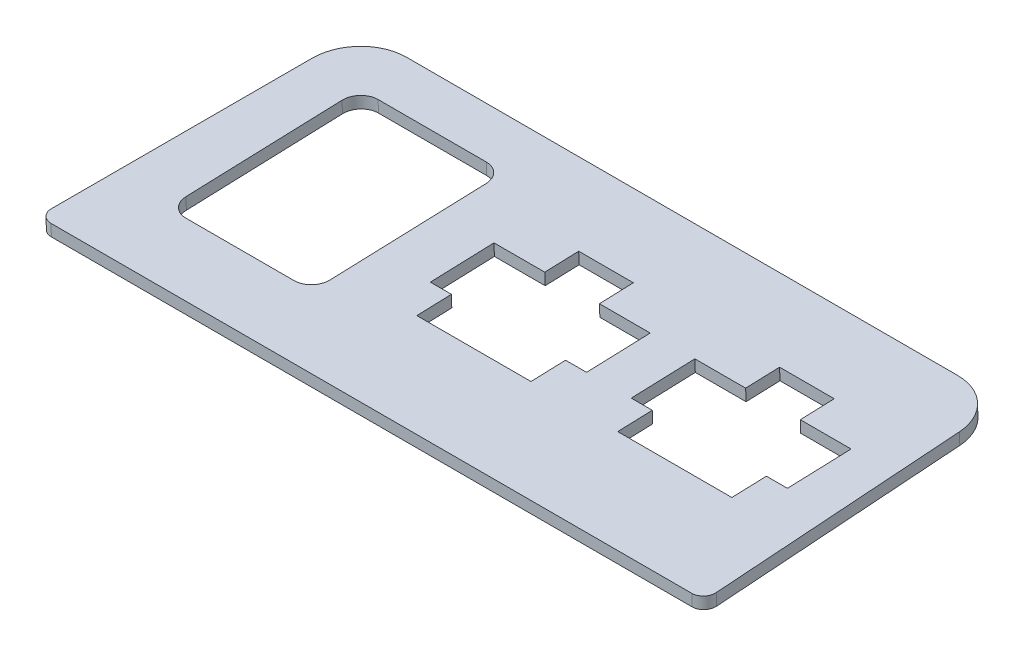
from build123d import *

# Parameters (mm, degrees)
BOSS_EXTRUDE1_DEPTH = 2
CUT_EXTRUDE1_REACH  = 75.082
FILLET1_R           = 2


with BuildPart() as part:
    # Sketch1 → Boss-Extrude1 (new body)
    with BuildSketch(Plane(origin=(0, -69.240689652, -2.417938163), x_dir=(1, 0, 0), z_dir=(0, 0.9993908270190958, 0.03489949670250105))):
        with BuildLine():
            Line((-55.400321558, -4.20689679), (55.400321558, -4.20689679))
            Line((55.400321558, -4.20689679), (53.862501323, 39.830512956))
            ThreePointArc((53.862501323, 39.830512956), (51.42464167, 45.306035386), (45.867374707, 47.551316983))
            Line((45.867374707, 47.551316983), (-45.867374707, 47.551316983))
            ThreePointArc((-45.867374707, 47.551316983), (-51.42464167, 45.306035386), (-53.862501323, 39.830512956))
            Line((-53.862501323, 39.830512956), (-55.400321558, -4.20689679))
        make_face()
    extrude(amount=BOSS_EXTRUDE1_DEPTH)

    # Sketch2 → Cut-Extrude1 (cut, up to next)
    with BuildSketch(Plane(origin=(0, -69.240689652, -2.417938163), x_dir=(1, 0, 0), z_dir=(0, -0.9993908270190958, -0.03489949670250106)), mode=Mode.PRIVATE) as cut_extrude1_sk1:
        Polygon((-4.05, -28.722210096), (-4.05, -34.372210096), (5.05, -34.372210096), (5.05, -28.722210096), (13.5, -28.722210096), (13.5, -18.122210096), (10, -18.122210096), (10, -12.372210096), (-9, -12.372210096), (-9, -18.122210096), (-12.5, -18.122210096), (-12.5, -28.722210096), align=None)
    cut_extrude1_tool1 = extrude(cut_extrude1_sk1.sketch, amount=-CUT_EXTRUDE1_REACH, mode=Mode.PRIVATE) & part.part
    # Sketch2 → Cut-Extrude1 (cut, up to next)
    with BuildSketch(Plane(origin=(0, -69.240689652, -2.417938163), x_dir=(1, 0, 0), z_dir=(0, -0.9993908270190958, -0.03489949670250106)), mode=Mode.PRIVATE) as cut_extrude1_sk2:
        with BuildLine():
            Line((-42.43540929, -7.372210096), (-24.43540929, -7.372210096))
            ThreePointArc((-24.43540929, -7.372210096), (-22.314088947, -8.250889753), (-21.43540929, -10.372210096))
            Line((-21.43540929, -10.372210096), (-21.43540929, -36.372210096))
            ThreePointArc((-21.43540929, -36.372210096), (-22.314088947, -38.49353044), (-24.43540929, -39.372210096))
            Line((-24.43540929, -39.372210096), (-42.43540929, -39.372210096))
            ThreePointArc((-42.43540929, -39.372210096), (-44.556729634, -38.49353044), (-45.43540929, -36.372210096))
            Line((-45.43540929, -36.372210096), (-45.43540929, -10.372210096))
            ThreePointArc((-45.43540929, -10.372210096), (-44.556729634, -8.250889753), (-42.43540929, -7.372210096))
        make_face()
    cut_extrude1_tool2 = extrude(cut_extrude1_sk2.sketch, amount=-CUT_EXTRUDE1_REACH, mode=Mode.PRIVATE) & part.part
    # Sketch2 → Cut-Extrude1 (cut, up to next)
    with BuildSketch(Plane(origin=(0, -69.240689652, -2.417938163), x_dir=(1, 0, 0), z_dir=(0, -0.9993908270190958, -0.03489949670250106)), mode=Mode.PRIVATE) as cut_extrude1_sk3:
        Polygon((29.38540929, -28.722210096), (20.93540929, -28.722210096), (20.93540929, -18.122210096), (24.43540929, -18.122210096), (24.43540929, -12.372210096), (43.43540929, -12.372210096), (43.43540929, -18.122210096), (46.93540929, -18.122210096), (46.93540929, -28.722210096), (38.48540929, -28.722210096), (38.48540929, -34.372210096), (29.38540929, -34.372210096), align=None)
    cut_extrude1_tool3 = extrude(cut_extrude1_sk3.sketch, amount=-CUT_EXTRUDE1_REACH, mode=Mode.PRIVATE) & part.part
    add(cut_extrude1_tool1.solids().sort_by_distance((0.5, -68.461294, -24.736904))[0], mode=Mode.SUBTRACT)
    add(cut_extrude1_tool2.solids().sort_by_distance((-33.435409, -68.425011, -25.775911))[0], mode=Mode.SUBTRACT)
    add(cut_extrude1_tool3.solids().sort_by_distance((33.935409, -68.461294, -24.736904))[0], mode=Mode.SUBTRACT)

    # Fillet1
    fillet1_edges = [part.edges().sort_by_distance(p)[0] for p in [
        (-55.400321558, -68.388117405, 1.821295396),
        (55.400321558, -68.388117405, 1.821295396),
    ]]
    fillet(fillet1_edges, radius=FILLET1_R)


solid = part.part
